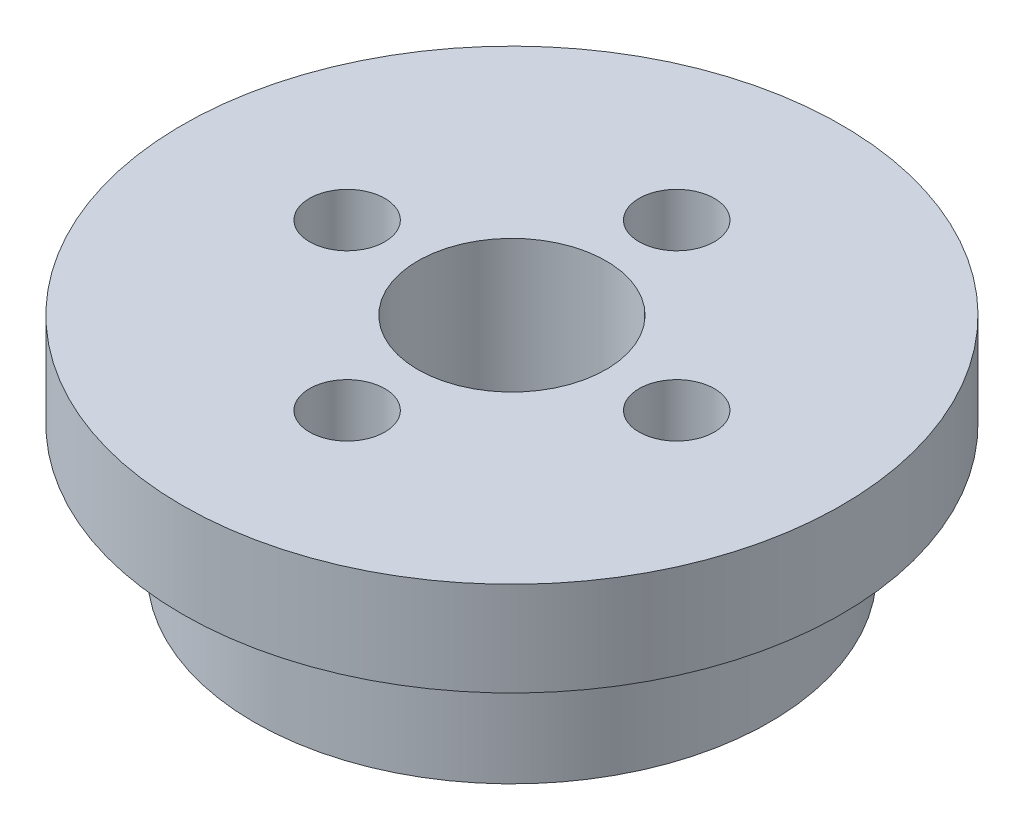
from build123d import *

# Parameters (mm, degrees)
SKETCH_3_R          = 10.95
EXTRUDE_1_DEPTH     = 5.5
SKETCH_4_R          = 14
EXTRUDE_2_DEPTH     = 4
SKETCH_5_R          = 4
SKETCH_5_R_2        = 1.6
CUT_EXTRUDE_1_DEPTH = 50


with BuildPart() as part:
    # 草图3 → 凸台-拉伸1 (new body)
    with BuildSketch(Plane(origin=(0, 0, 0), x_dir=(1, 0, 0), z_dir=(0, 1, 0))):
        Circle(SKETCH_3_R)
    extrude(amount=EXTRUDE_1_DEPTH)

    # 草图4 → 凸台-拉伸2 (add)
    with BuildSketch(Plane(origin=(0, 5.5, 0), x_dir=(1, 0, 0), z_dir=(0, 1, 0))):
        Circle(SKETCH_4_R)
    extrude(amount=EXTRUDE_2_DEPTH)

    # 草图5 → 切除-拉伸1 (cut)
    with BuildSketch(Plane(origin=(0, 9.5, 0), x_dir=(1, 0, 0), z_dir=(0, 1, 0))):
        Circle(SKETCH_5_R)
        with Locations((0, 7)):
            Circle(SKETCH_5_R_2)
        with Locations((7, 0)):
            Circle(SKETCH_5_R_2)
        with Locations((0, -7)):
            Circle(SKETCH_5_R_2)
        with Locations((-7, 0)):
            Circle(SKETCH_5_R_2)
    extrude(amount=-CUT_EXTRUDE_1_DEPTH, mode=Mode.SUBTRACT)


solid = part.part
